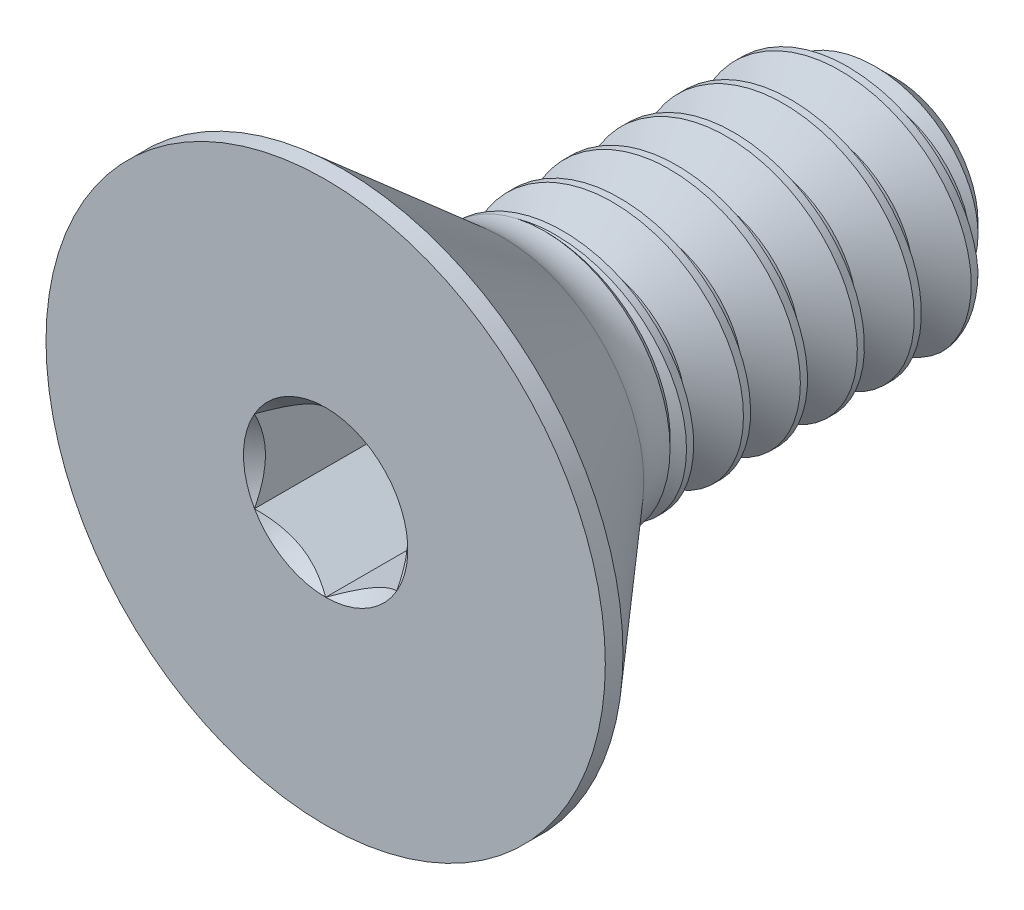
from build123d import *

# Parameters (mm, degrees)
SKETCH1_W          = 7.9375
SKETCH1_H          = 1.7526
CHAMFER1_SIZE      = 0.5953125
CUT_SWEEP1_PITCH   = 0.79375
CUT_EXTRUDE2_DEPTH = 1.72466


with BuildPart() as part:
    # Sketch1 → Revolve1 (revolve)
    with BuildSketch(Plane(origin=(0, 0, 0), x_dir=(0, 0, -1), z_dir=(1, 0, 0))):
        with Locations((3.96875, 0.8763)):
            Rectangle(SKETCH1_W, SKETCH1_H)
    revolve(axis=Axis((0, 0, -7.9375), (0, 0, 1)))

    # Chamfer1
    chamfer1_edges = [part.edges().sort_by_distance(p)[0] for p in [
        (0, -1.7526, -7.9375),
    ]]
    chamfer(chamfer1_edges, length=CHAMFER1_SIZE)

    # Cut-Sweep1: the profile of Sketch2 profile screwed along a right-hand helix of 10 turns, 8 arcs to a turn; built about Z, then put on its axis
    cut_sweep1_z = Axis((0, 0, 0), (0, 0, 1))
    cut_sweep1_corners = [(1.7529, 0, 0.000173205), (1.7529, 0, -0.694704455), (1.237044252, 0, -0.396875), (1.237044252, 0, -0.29765625)]
    with BuildLine(mode=Mode.PRIVATE) as cut_sweep1_profile:
        Line(cut_sweep1_corners[0], cut_sweep1_corners[1])
        Line(cut_sweep1_corners[1], cut_sweep1_corners[2])
        Line(cut_sweep1_corners[2], cut_sweep1_corners[3])
        Line(cut_sweep1_corners[3], cut_sweep1_corners[0])
    cut_sweep1_cap = Face(cut_sweep1_profile.wire())
    cut_sweep1_turn_angles = [0, 22.5, 45, 67.5, 90, 112.5, 135, 157.5, 180, 202.5, 225, 247.5, 270, 292.5, 315, 337.5, 360]
    cut_sweep1_turn_weights = [1, 0.9238795325112867, 1, 0.9238795325112867, 1, 0.9238795325112867, 1, 0.9238795325112867, 1, 0.9238795325112867, 1, 0.9238795325112867, 1, 0.9238795325112867, 1, 0.9238795325112867, 1]
    cut_sweep1_turn_rails = [Edge.make_bspline([Vector(p[0], p[1], 0).rotate(cut_sweep1_z, cut_sweep1_turn_angles[k]) / cut_sweep1_turn_weights[k] + Vector(0, 0, p[2] + CUT_SWEEP1_PITCH * cut_sweep1_turn_angles[k] / 360) for k in range(17)], [0, 0, 0, 1, 1, 2, 2, 3, 3, 4, 4, 5, 5, 6, 6, 7, 7, 8, 8, 8], 2, cut_sweep1_turn_weights) for p in cut_sweep1_corners]
    cut_sweep1_turn_sides = [Face.make_surface_from_curves(cut_sweep1_turn_rails[p[0]], cut_sweep1_turn_rails[p[1]]) for p in [(0, 1), (1, 2), (2, 3), (3, 0)]]
    cut_sweep1 = Plane(origin=(0, 0, -7.9375), x_dir=(0, 1, 0), z_dir=(0, 0, 1)) * Solid(Shell([*[p.moved(Location((0, 0, CUT_SWEEP1_PITCH * i))) for i in range(10) for p in cut_sweep1_turn_sides], cut_sweep1_cap, cut_sweep1_cap.rotate(cut_sweep1_z, 3600).moved(Location((0, 0, CUT_SWEEP1_PITCH * 3600 / 360)))]))
    add(cut_sweep1, mode=Mode.SUBTRACT)

    # Sketch7 → Revolve2 (revolve)
    with BuildSketch(Plane(origin=(0, 0, 0), x_dir=(0, 0, -1), z_dir=(1, 0, 0)), mode=Mode.PRIVATE) as revolve2_sk:
        with BuildLine():
            Line((0, 3.8989), (0.24638, 3.8989))
            Line((0.24638, 3.8989), (2.4638, 1.971326202))
            ThreePointArc((2.4638, 1.971326202), (2.73652883, 1.809069598), (3.048809801, 1.7526))
            Line((3.048809801, 1.7526), (3.048809801, 0))
            Line((3.048809801, 0), (0, 0))
            Line((0, 0), (0, 3.8989))
        make_face()
    revolve(revolve2_sk.sketch.rotate(Axis((0, 0, 0), (0, 0, -1)), 189.052465709), axis=Axis((0, 0, 0), (0, 0, -1)))

    # Boss-Extrude1 cone 1 section (through the dimple's axis) → Boss-Extrude1 (revolve)
    with BuildSketch(Plane(origin=(0, 0, -3.048809801), x_dir=(0, -1, 0), z_dir=(1, 0, 0))):
        Polygon((0, 0), (1.7526, 0), (0, 1.7526), align=None)
    revolve(axis=Axis((0, 0, -3.048809801), (0, 0, -1)))

    # Sketch5 → Cut-Extrude2 (cut)
    with BuildSketch(Plane.XY):
        Polygon((0.9921875, -0.57283972), (0.9921875, 0.57283972), (0, 1.14567944), (-0.9921875, 0.57283972), (-0.9921875, -0.57283972), (0, -1.14567944), align=None)
    extrude(amount=-CUT_EXTRUDE2_DEPTH, mode=Mode.SUBTRACT)

    # Cut-Extrude3 cone 1 section (through the dimple's axis) → Cut-Extrude3 (revolve, cut)
    with BuildSketch(Plane(origin=(0, 0, 0), x_dir=(0, -1, 0), z_dir=(1, 0, 0))):
        Polygon((0, 0), (1.14567944, 0), (0, 1.14567944), align=None)
    revolve(axis=Axis((0, 0, 0), (0, 0, -1)), mode=Mode.SUBTRACT)


solid = part.part
